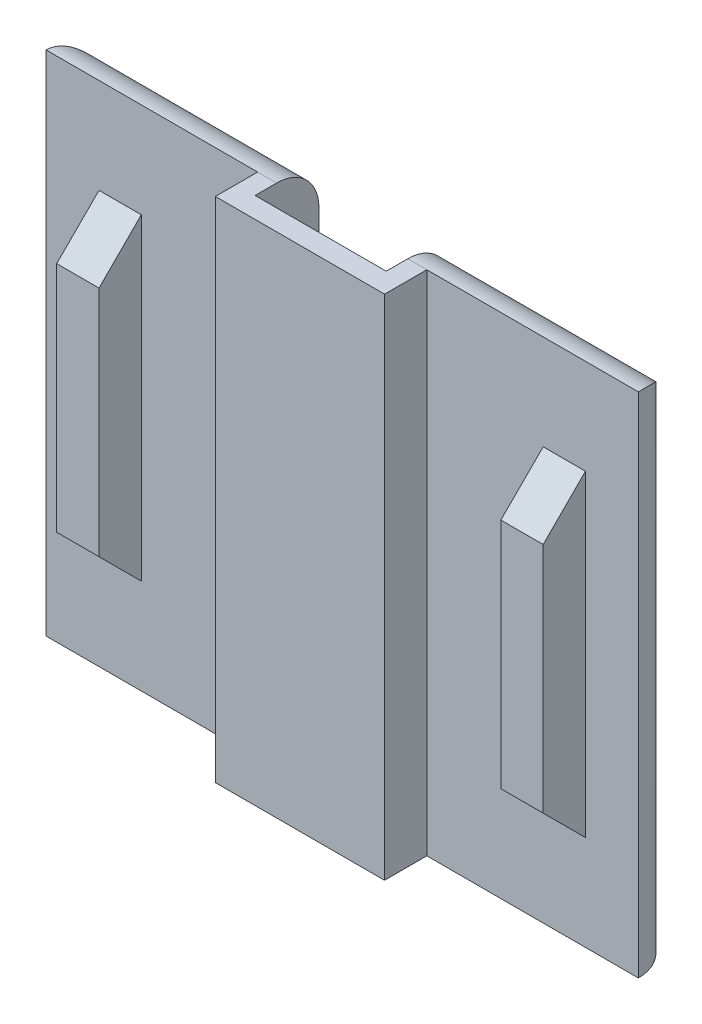
from build123d import *

# Parameters (mm, degrees)
SKETCH1_W           = 14
SKETCH1_H           = 12
BOSS_EXTRUDE1_DEPTH = 1
SKETCH2_W           = 4
SKETCH2_H           = 12
BOSS_EXTRUDE2_DEPTH = 1
SKETCH3_W           = 3.1
SKETCH3_H           = 1.51
CUT_EXTRUDE1_DEPTH  = 15.035668848
SKETCH6_W           = 1
SKETCH6_H           = 9.5
BOSS_EXTRUDE5_DEPTH = 1
FILLET2_R           = 1
SKETCH7_W           = 1
SKETCH7_H           = 1
CUT_EXTRUDE2_DEPTH  = 1
CHAMFER1_SIZE       = 1


with BuildPart() as part:
    # Sketch1 → Boss-Extrude1 (new body)
    with BuildSketch(Plane.XY):
        Rectangle(SKETCH1_W, SKETCH1_H)
    extrude(amount=BOSS_EXTRUDE1_DEPTH)

    # Sketch2 → Boss-Extrude2 (add)
    with BuildSketch(Plane.XY.offset(1)):
        Rectangle(SKETCH2_W, SKETCH2_H)
    extrude(amount=BOSS_EXTRUDE2_DEPTH)

    # Sketch3 → Cut-Extrude1 (cut, through all)
    with BuildSketch(Plane(origin=(0, 6, 0), x_dir=(1, 0, 0), z_dir=(0, 1, 0))):
        with Locations((0, -0.755)):
            Rectangle(SKETCH3_W, SKETCH3_H)
    extrude(amount=-CUT_EXTRUDE1_DEPTH, mode=Mode.SUBTRACT)

    # Sketch6 → Boss-Extrude5 (add)
    with BuildSketch(Plane.XY.offset(1)):
        with Locations((5.25, 0)):
            Rectangle(SKETCH6_W, SKETCH6_H)
        with Locations((-5.25, 0)):
            Rectangle(SKETCH6_W, SKETCH6_H)
    extrude(amount=BOSS_EXTRUDE5_DEPTH)

    # Fillet2
    fillet2_edges = [part.edges().sort_by_distance(p)[0] for p in [
        (-4.275, 6, 0),
        (4.275, 6, 0),
        (7, 0, 0),
        (-7, 0, 0),
    ]]
    fillet(fillet2_edges, radius=FILLET2_R - 0.0001)  # a hair under: the kernel refuses the full size

    # Sketch7 → Cut-Extrude2 (cut)
    with BuildSketch(Plane.XY.offset(2)):
        with Locations((-5.25, -4.25)):
            Rectangle(SKETCH7_W, SKETCH7_H)
        with Locations((5.25, -4.25)):
            Rectangle(SKETCH7_W, SKETCH7_H)
        with Locations((-5.25, 4.25)):
            Rectangle(SKETCH7_W, SKETCH7_H)
        with Locations((5.25, 4.25)):
            Rectangle(SKETCH7_W, SKETCH7_H)
    extrude(amount=-CUT_EXTRUDE2_DEPTH, mode=Mode.SUBTRACT)

    # Chamfer1
    chamfer1_edges = [part.edges().sort_by_distance(p)[0] for p in [
        (5.25, -3.75, 2),
        (-5.25, -3.75, 2),
        (5.25, 3.75, 2),
        (-5.25, 3.75, 2),
    ]]
    chamfer(chamfer1_edges, length=CHAMFER1_SIZE - 0.0001)  # a hair under: the kernel refuses the full size


solid = part.part
